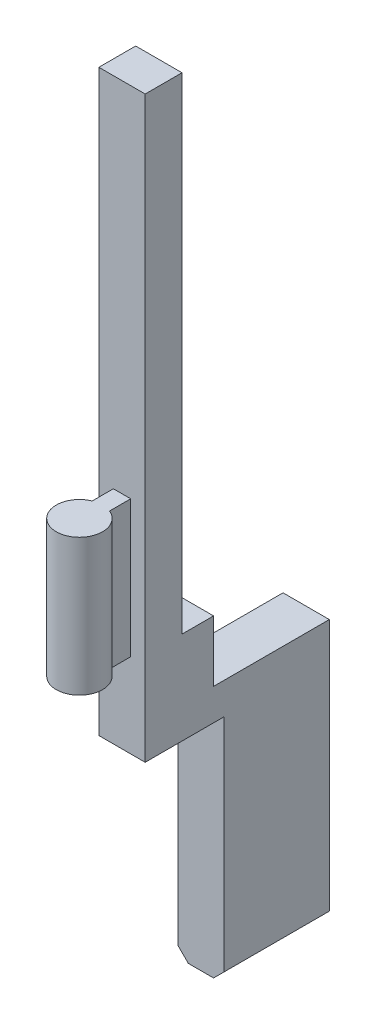
from build123d import *

# Parameters (mm, degrees)
SZKIC1_W                    = 4.4
SZKIC1_H                    = 21
DODANIE_WYCI_GNI_CIE1_DEPTH = 6.5
DODANIE_WYCI_GNI_CIE2_DEPTH = 13
SKETCH1_W                   = 4.4
SKETCH1_H                   = 5
BOSS_EXTRUDE1_DEPTH         = 11
SKETCH3_W                   = 4.4
SKETCH3_H                   = 10
BOSS_EXTRUDE3_DEPTH         = 22
CHAMFER1_SIZE               = 1
SKETCH5_W                   = 4.4
SKETCH5_H                   = 3
CUT_EXTRUDE1_DEPTH          = 12.2
SZKIC4_W                    = 4.4
SZKIC4_H                    = 3.5
DODANIE_WYCI_GNI_CIE3_DEPTH = 34
SZKIC5_W                    = 11
SZKIC5_H                    = 2
WYTNIJ_WYCI_GNI_CIE1_DEPTH  = 10


with BuildPart() as part:
    # Szkic1 → Dodanie-wyciągnięcie1 (new body)
    with BuildSketch(Plane.XY):
        Rectangle(SZKIC1_W, SZKIC1_H)
    extrude(amount=DODANIE_WYCI_GNI_CIE1_DEPTH)

    # Szkic3 → Dodanie-wyciągnięcie2 (add)
    with BuildSketch(Plane(origin=(0, 10.5, 0), x_dir=(1, 0, 0), z_dir=(0, 1, 0))):
        with BuildLine():
            Line((0.825, -8.510545416), (0.825, -6.5))
            Line((0.825, -6.5), (-0.825, -6.5))
            Line((-0.825, -6.5), (-0.825, -8.510545416))
            ThreePointArc((-0.825, -8.510545416), (0, -12.75), (0.825, -8.510545416))
        make_face()
    extrude(amount=-DODANIE_WYCI_GNI_CIE2_DEPTH)

    # Sketch1 → Boss-Extrude1 (add)
    with BuildSketch(Plane(origin=(0, 0, 0), x_dir=(-1, 0, 0), z_dir=(0, 0, -1))):
        with Locations((0, -8)):
            Rectangle(SKETCH1_W, SKETCH1_H)
    extrude(amount=BOSS_EXTRUDE1_DEPTH)

    # Sketch3 → Boss-Extrude3 (add)
    with BuildSketch(Plane.XZ.offset(10.5)):
        with Locations((0, -6)):
            Rectangle(SKETCH3_W, SKETCH3_H)
    extrude(amount=BOSS_EXTRUDE3_DEPTH)

    # Chamfer1
    chamfer1_edges = [part.edges().sort_by_distance(p)[0] for p in [
        (2.2, -32.5, -6),
        (-2.2, -32.5, -6),
        (0, -5.5, -11),
    ]]
    chamfer(chamfer1_edges, length=CHAMFER1_SIZE)

    # Sketch5 → Cut-Extrude1 (cut)
    with BuildSketch(Plane(origin=(0, 10.5, 0), x_dir=(1, 0, 0), z_dir=(0, 1, 0))):
        with Locations((0, -1.5)):
            Rectangle(SKETCH5_W, SKETCH5_H)
    extrude(amount=-CUT_EXTRUDE1_DEPTH, mode=Mode.SUBTRACT)

    # Szkic4 → Dodanie-wyciągnięcie3 (add)
    with BuildSketch(Plane(origin=(0, 10.5, 0), x_dir=(1, 0, 0), z_dir=(0, 1, 0))):
        with Locations((0, -4.75)):
            Rectangle(SZKIC4_W, SZKIC4_H)
    extrude(amount=DODANIE_WYCI_GNI_CIE3_DEPTH)

    # Szkic5 → Wytnij-wyciągnięcie1 (cut)
    with BuildSketch(Plane.ZY.offset(2.2)):
        with Locations((-5.5, -6.5)):
            Rectangle(SZKIC5_W, SZKIC5_H)
    extrude(amount=-WYTNIJ_WYCI_GNI_CIE1_DEPTH, mode=Mode.SUBTRACT)


solid = part.part
